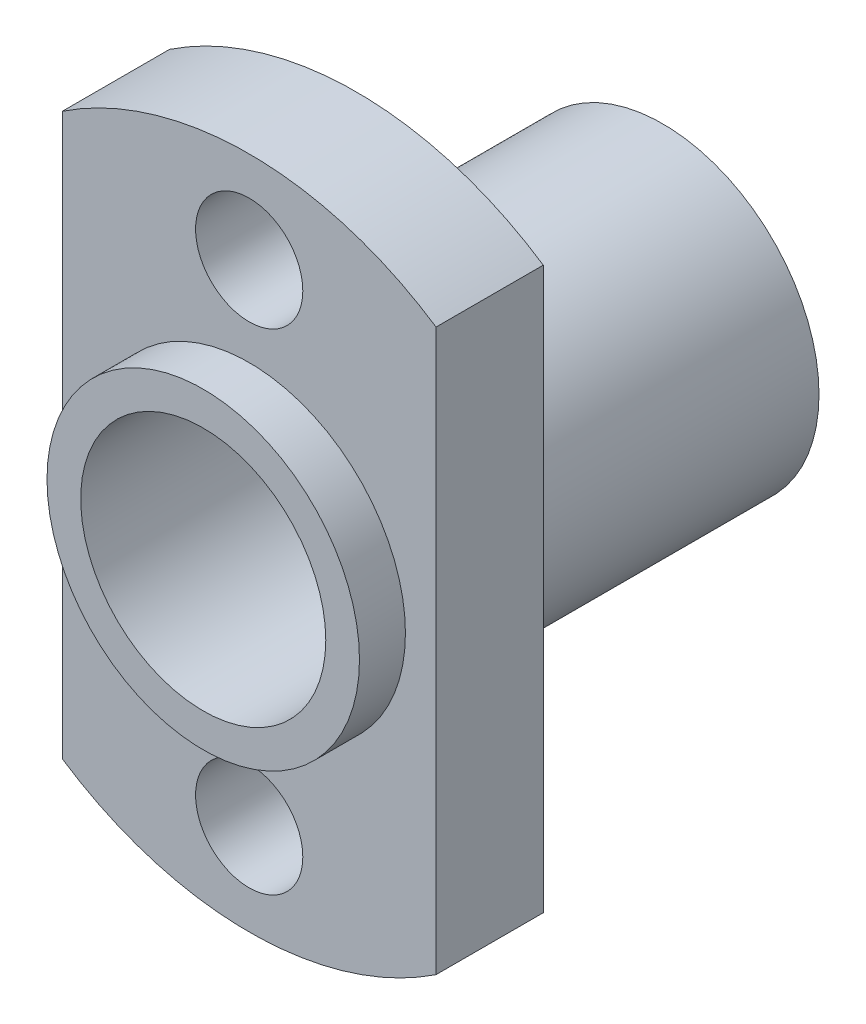
from build123d import *

# Parameters (mm, degrees)
SKETCH1_R                = 5.1
SKETCH1_R_2              = 1.75
BOSS_EXTRUDE1_DEPTH      = 3.5
BOSS_EXTRUDE2_DEPTH      = 1.5
BOSS_EXTRUDE2_DEPTH_BACK = 13.5
SKETCH2_R                = 5.1
SKETCH2_R_2              = 4


with BuildPart() as part:
    # Sketch1 → Boss-Extrude1 (new body)
    with BuildSketch(Plane.XY):
        with BuildLine():
            Line((-6.1, -9.153687781), (-6.1, 9.153687781))
            ThreePointArc((-6.1, 9.153687781), (0, 11), (6.1, 9.153687781))
            Line((6.1, 9.153687781), (6.1, -9.153687781))
            ThreePointArc((6.1, -9.153687781), (0, -11), (-6.1, -9.153687781))
        make_face()
        Circle(SKETCH1_R, mode=Mode.SUBTRACT)
        with Locations((0, 8)):
            Circle(SKETCH1_R_2, mode=Mode.SUBTRACT)
        with Locations((0, -8)):
            Circle(SKETCH1_R_2, mode=Mode.SUBTRACT)
    extrude(amount=-BOSS_EXTRUDE1_DEPTH)

    # Sketch2 → Boss-Extrude2 (add, two sides: drawn at the far end of the back side and taken through both)
    with BuildSketch(Plane.XY.offset(-BOSS_EXTRUDE2_DEPTH_BACK)):
        Circle(SKETCH2_R)
        Circle(SKETCH2_R_2, mode=Mode.SUBTRACT)
    extrude(amount=BOSS_EXTRUDE2_DEPTH + BOSS_EXTRUDE2_DEPTH_BACK)


solid = part.part
